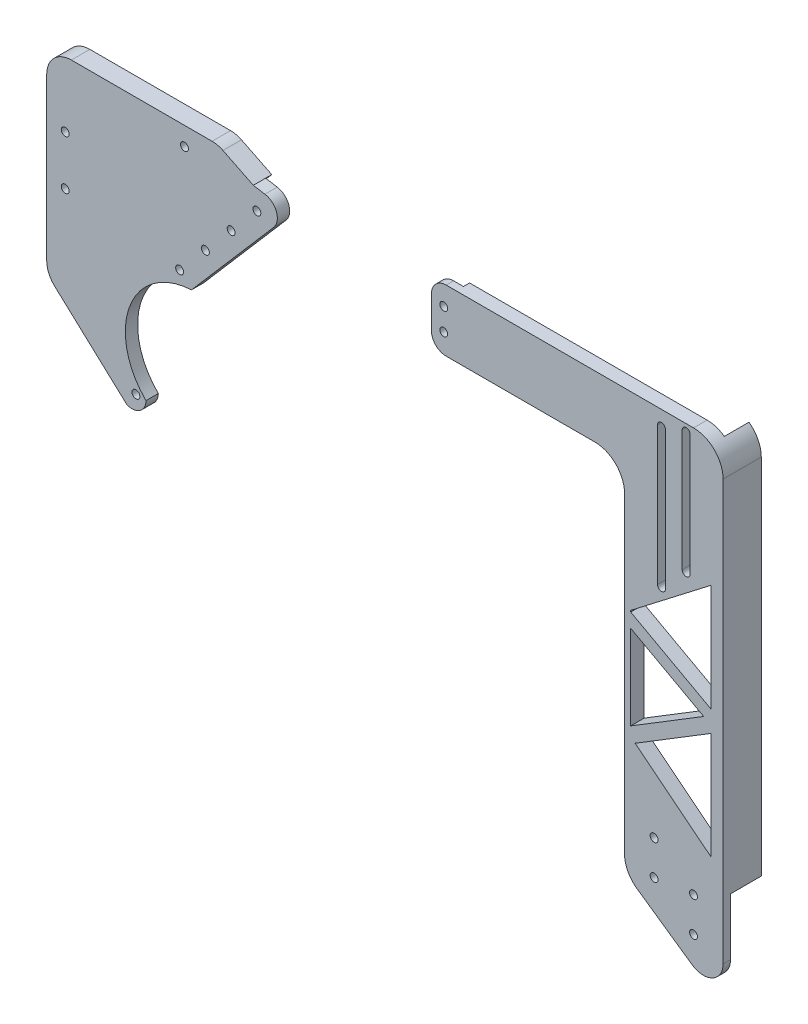
from build123d import *

# Parameters (mm, degrees)
SKETCH1_R               = 2.032
BOSS_EXTRUDE1_DEPTH     = 9.525
BOSS_EXTRUDE1_2_DEPTH   = 9.525
SKETCH10_R              = 2.032
CUT_EXTRUDE3_DEPTH      = 505.716620506
CUT_EXTRUDE7_DEPTH      = 3.175
CUT_EXTRUDE7_DEPTH_BACK = 3.175
SKETCH14_R              = 35.71875
CUT_EXTRUDE6_DEPTH      = 505.716620506
BOSS_EXTRUDE3_DEPTH     = 12.7
FILLET1_R               = 15.24
FILLET2_R               = 10.16
FILLET3_R               = 15.24
FILLET4_R               = 12.7
FILLET5_R               = 7.62
FILLET6_R               = 7.62
CHAMFER2_SIZE           = 78.937341236
CHAMFER2_SIZE_2         = 25.663678416
FILLET8_R               = 25.4
SKETCH21_R              = 2.032
CUT_EXTRUDE11_DEPTH     = 506.115919384
FILLET9_R               = 15.24
CUT_EXTRUDE12_DEPTH     = 506.115919384
FILLET10_R              = 25.4
SKETCH23_W              = 165.201475287
SKETCH23_H              = 262.526692249
CUT_EXTRUDE13_DEPTH     = 2.54
CUT_EXTRUDE14_DEPTH     = 506.115919384
FILLET11_R              = 12.7


with BuildPart() as part:
    # Sketch1 → Boss-Extrude1 (new body)
    with BuildSketch(Plane.XY):
        with BuildLine():
            Line((31.75, 205.268478835), (63.526916125, 176.032542018))
            ThreePointArc((63.526916125, 176.032542018), (70.242448928, 176.767135473), (73.38049942, 182.749663991))
            Line((73.38049942, 182.749663991), (68.207436956, 210.723368229))
            Line((68.207436956, 210.723368229), (62.773116672, 209.910266196))
            ThreePointArc((62.773116672, 209.910266196), (73.222852829, 233.478442621), (96.815196352, 243.87350168))
            Line((96.815196352, 243.87350168), (148.1328, 303.339375457))
            Line((148.1328, 303.339375457), (50.8, 319.304876528))
            Line((50.8, 319.304876528), (50.8, 344.968478835))
            Line((50.8, 344.968478835), (0, 344.968478835))
            Line((0, 344.968478835), (0, 205.268478835))
            Line((0, 205.268478835), (31.75, 205.268478835))
        make_face()
        with Locations(Location((68.207436956, 182.986005094, 0), (0, 0, 180))):
            Circle(SKETCH1_R, mode=Mode.SUBTRACT)
        with Locations(Location((117.273068912, 280.544234407, 0), (0, 0, 180))):
            Circle(SKETCH1_R, mode=Mode.SUBTRACT)
        with Locations(Location((130.548802245, 295.927904466, 0), (0, 0, 180))):
            Circle(SKETCH1_R, mode=Mode.SUBTRACT)
        with Locations(Location((90.721602245, 249.776894291, 0), (0, 0, 180))):
            Circle(SKETCH1_R, mode=Mode.SUBTRACT)
        with Locations(Location((103.997335578, 265.160564349, 0), (0, 0, 180))):
            Circle(SKETCH1_R, mode=Mode.SUBTRACT)
    extrude(amount=BOSS_EXTRUDE1_DEPTH)


with BuildPart() as body_2:
    # Sketch1 → Boss-Extrude1 2 (new body)
    with BuildSketch(Plane.XY):
        Polygon((317.5, 93.368773367), (368.3, 58.045157036), (368.3, 309.154478835), (217.96375, 309.154478835), (217.96375, 277.404478835), (317.5, 277.404478835), align=None)
        with Locations(Location((353.06, 83.000200579, 0), (0, 0, 180))):
            Circle(SKETCH1_R, mode=Mode.SUBTRACT)
        with Locations(Location((353.06, 100.780200579, 0), (0, 0, 180))):
            Circle(SKETCH1_R, mode=Mode.SUBTRACT)
        with Locations(Location((332.74, 98.240200579, 0), (0, 0, 180))):
            Circle(SKETCH1_R, mode=Mode.SUBTRACT)
        with Locations(Location((332.74, 116.020200579, 0), (0, 0, 180))):
            Circle(SKETCH1_R, mode=Mode.SUBTRACT)
    extrude(amount=BOSS_EXTRUDE1_2_DEPTH)

    # Sketch10 → Cut-Extrude3 (cut, through all)
    with BuildSketch(Plane(origin=(0, 0, 0), x_dir=(-1, 0, 0), z_dir=(0, 0, -1))):
        with Locations((-224.31375, 287.564478835)):
            Circle(SKETCH10_R)
        with Locations((-224.31375, 298.994478835)):
            Circle(SKETCH10_R)
    extrude(amount=-CUT_EXTRUDE3_DEPTH, mode=Mode.SUBTRACT)


with BuildPart() as cut_extrude7_tool:
    # Sketch12 → Cut-Extrude7 (new, two sides: drawn at the far end of the back side and taken through both)
    with BuildSketch(Plane.XY.offset(-CUT_EXTRUDE7_DEPTH_BACK)):
        with BuildLine():
            Line((82.55, -20.156521165), (82.55, -6.186521165))
            Line((82.55, -6.186521165), (107.95, -6.186521165))
            Line((107.95, -6.186521165), (107.95, -20.156521165))
            Line((107.95, -20.156521165), (260.35, -20.156521165))
            Line((260.35, -20.156521165), (260.35, -6.186521165))
            Line((260.35, -6.186521165), (285.75, -6.186521165))
            Line((285.75, -6.186521165), (285.75, -20.156521165))
            Line((285.75, -20.156521165), (368.3, -20.156521165))
            Line((368.3, -20.156521165), (368.3, 106.843478835))
            Line((368.3, 106.843478835), (230.66375, 202.728478835))
            Line((230.66375, 202.728478835), (230.66375, 338.618478835))
            Line((230.66375, 338.618478835), (213.19998, 344.968478835))
            Line((213.19998, 344.968478835), (203.2, 344.968478835))
            Line((203.2, 344.968478835), (161.925, 344.968478835))
            Line((161.925, 344.968478835), (0, 157.643478835))
            Line((0, 157.643478835), (0, 0.163478835))
            Line((0, 0.163478835), (0, -6.186521165))
            ThreePointArc((0, -6.186521165), (0.047577015, -6.962384889), (0.189595124, -7.726622384))
            Line((0.189595124, -7.726622384), (1.777095124, -14.076622384))
            ThreePointArc((1.777095124, -14.076622384), (3.987212552, -17.508213943), (7.829508682, -18.885602821))
            Line((7.829508682, -18.885602821), (82.55, -20.156521165))
        make_face()
    extrude(amount=CUT_EXTRUDE7_DEPTH + CUT_EXTRUDE7_DEPTH_BACK)


with BuildPart() as part_1:
    add(part.part)

    # Cut-Extrude7: cut by cut_extrude7_tool
    add(cut_extrude7_tool.part, mode=Mode.SUBTRACT)

    # Sketch14 → Cut-Extrude6 (cut, through all)
    with BuildSketch(Plane.XY.offset(9.525)):
        with Locations((98.450523716, 208.192206776)):
            Circle(SKETCH14_R)
    extrude(amount=-CUT_EXTRUDE6_DEPTH, mode=Mode.SUBTRACT)

    # Fillet4
    fillet4_edges = [part_1.edges().sort_by_distance(p)[0] for p in [
        (0, 344.968478835, 4.7625),
    ]]
    fillet(fillet4_edges, radius=FILLET4_R)

    # Fillet5
    fillet5_edges = [part_1.edges().sort_by_distance(p)[0] for p in [
        (148.1328, 303.339375457, 6.35),
    ]]
    fillet(fillet5_edges, radius=FILLET5_R)

    # Chamfer2
    # the kernel refuses this chamfer: 78.937341236, 25.663678416 mm, written as the material it adds along each edge
    with BuildSketch(Plane(origin=(50.8, 319.304876528, 0), x_dir=(0.984932368742644, -0.17293995779750906, 0), z_dir=(0, 0, 1))) as chamfer2_piece_1_section:
        Polygon((CHAMFER2_SIZE * 0.999936925949, CHAMFER2_SIZE * 0.0112313901092), (-CHAMFER2_SIZE_2 * 0.172939957798, CHAMFER2_SIZE_2 * 0.984932368743), (0, 0), align=None)
    chamfer2_piece_1 = extrude(amount=9.525, mode=Mode.PRIVATE)
    chamfer2_piece_1 = split(chamfer2_piece_1, bisect_by=Plane(origin=(77.682316476, 344.968478835, 4.7625), z_dir=(0, -1, 0)), keep=Keep.TOP, mode=Mode.PRIVATE)
    add(chamfer2_piece_1)

    # Fillet8
    fillet8_edges = [part_1.edges().sort_by_distance(p)[0] for p in [
        (50.800154226, 344.968478835, 4.7625),
    ]]
    fillet(fillet8_edges, radius=FILLET8_R)


with BuildPart() as body_2_1:
    add(body_2.part)

    # Cut-Extrude7: cut by cut_extrude7_tool
    add(cut_extrude7_tool.part, mode=Mode.SUBTRACT)

    # Sketch17 → Boss-Extrude3 (add)
    with BuildSketch(Plane(origin=(0, 0, 0), x_dir=(-1, 0, 0), z_dir=(0, 0, -1))):
        Polygon((-361.95, 141.371988609), (-368.3, 141.371988609), (-368.3, 106.843478835), (-361.95, 111.267238928), align=None)
        Polygon((-368.3, 309.154478835), (-368.3, 141.371988609), (-361.95, 145.795748701), (-361.95, 309.154478835), align=None)
        Polygon((-361.95, 145.795748701), (-368.3, 141.371988609), (-361.95, 141.371988609), align=None)
    extrude(amount=BOSS_EXTRUDE3_DEPTH)

    # Fillet1
    fillet1_edges = [body_2_1.edges().sort_by_distance(p)[0] for p in [
        (317.5, 93.368773367, 6.35),
    ]]
    fillet(fillet1_edges, radius=FILLET1_R)

    # Fillet2
    fillet2_edges = [body_2_1.edges().sort_by_distance(p)[0] for p in [
        (368.3, 58.045157036, 6.35),
    ]]
    fillet(fillet2_edges, radius=FILLET2_R)

    # Fillet3
    fillet3_edges = [body_2_1.edges().sort_by_distance(p)[0] for p in [
        (368.3, 309.154478835, -1.5875),
    ]]
    fillet(fillet3_edges, radius=FILLET3_R)

    # Fillet6
    fillet6_edges = [body_2_1.edges().sort_by_distance(p)[0] for p in [
        (217.96375, 309.154478835, 6.35),
        (217.96375, 277.404478835, 6.35),
    ]]
    fillet(fillet6_edges, radius=FILLET6_R)


with BuildPart() as cut_extrude11_tool:
    # Sketch21 → Cut-Extrude11 (new, through all)
    with BuildSketch(Plane.XY.offset(9.525)):
        with Locations((93.218, 306.024990993)):
            Circle(SKETCH21_R)
        with Locations((31.75, 281.894891291)):
            Circle(SKETCH21_R)
        with Locations((31.75, 256.494891291)):
            Circle(SKETCH21_R)
        with BuildLine():
            Line((338.582, 229.930534279), (338.582, 301.256423392))
            ThreePointArc((338.582, 301.256423392), (336.55, 303.288423392), (334.518, 301.256423392))
            Line((334.518, 301.256423392), (334.518, 229.930534279))
            ThreePointArc((334.518, 229.930534279), (336.55, 227.898534279), (338.582, 229.930534279))
        make_face()
        with BuildLine():
            Line((351.282, 242.92341657), (351.282, 305.352926996))
            ThreePointArc((351.282, 305.352926996), (349.25, 307.384926996), (347.218, 305.352926996))
            Line((347.218, 305.352926996), (347.218, 242.92341657))
            ThreePointArc((347.218, 242.92341657), (349.25, 240.89141657), (351.282, 242.92341657))
        make_face()
    extrude(amount=-CUT_EXTRUDE11_DEPTH)


with BuildPart() as part_2:
    add(part_1.part)

    # Cut-Extrude11: cut by cut_extrude11_tool
    add(cut_extrude11_tool.part, mode=Mode.SUBTRACT)

    # Fillet10
    fillet10_edges = [part_2.edges().sort_by_distance(p)[0] for p in [
        (0, 205.268478835, 4.7625),
    ]]
    fillet(fillet10_edges, radius=FILLET10_R)

    # Sketch24 → Cut-Extrude14 (cut, through all)
    with BuildSketch(Plane.XY.offset(9.525)):
        with BuildLine():
            Line((110.413379571, 315.549990993), (22.225, 315.549990993))
            Line((22.225, 315.549990993), (22.225, 214.031830732))
            Line((22.225, 214.031830732), (31.75, 205.268478835))
            Line((31.75, 205.268478835), (25.4, 205.268478835))
            ThreePointArc((25.4, 205.268478835), (7.439487758, 212.707966593), (0, 230.668478835))
            Line((0, 230.668478835), (0, 332.268478835))
            ThreePointArc((0, 332.268478835), (3.719743879, 341.248734956), (12.7, 344.968478835))
            Line((12.7, 344.968478835), (44.874001569, 344.968478835))
            ThreePointArc((44.874001569, 344.968478835), (50.645159084, 344.304156326), (56.114433935, 342.345938751))
            Line((56.114433935, 342.345938751), (110.413379571, 315.549990993))
        make_face()
    extrude(amount=-CUT_EXTRUDE14_DEPTH, mode=Mode.SUBTRACT)

    # Fillet11
    fillet11_edges = [part_2.edges().sort_by_distance(p)[0] for p in [
        (110.413379571, 315.549990993, 4.7625),
        (22.225, 214.031830732, 4.7625),
        (22.225, 315.549990993, 4.7625),
    ]]
    fillet(fillet11_edges, radius=FILLET11_R)


with BuildPart() as body_2_2:
    add(body_2_1.part)

    # Cut-Extrude11: cut by cut_extrude11_tool
    add(cut_extrude11_tool.part, mode=Mode.SUBTRACT)

    # Fillet9
    fillet9_edges = [body_2_2.edges().sort_by_distance(p)[0] for p in [
        (317.5, 277.404478835, 4.7625),
    ]]
    fillet(fillet9_edges, radius=FILLET9_R)

    # Sketch22 → Cut-Extrude12 (cut, through all)
    with BuildSketch(Plane.XY.offset(9.525)):
        Polygon((361.95, 177.1809505), (323.018835042, 153.35264592), (361.95, 122.256727778), align=None)
        Polygon((320.675, 203.515670499), (320.675, 159.925515468), (358.302987619, 182.95619412), align=None)
        Polygon((320.675, 210.75171691), (361.95, 188.199557169), (361.95, 243.283874943), (320.675, 211.487182235), align=None)
    extrude(amount=-CUT_EXTRUDE12_DEPTH, mode=Mode.SUBTRACT)

    # Sketch23 → Cut-Extrude13 (cut)
    with BuildSketch(Plane.XY.offset(9.525)):
        with Locations((294.04489443, 184.598565898)):
            Rectangle(SKETCH23_W, SKETCH23_H)
    extrude(amount=-CUT_EXTRUDE13_DEPTH, mode=Mode.SUBTRACT)


solid = Compound([part_2.part, body_2_2.part])
